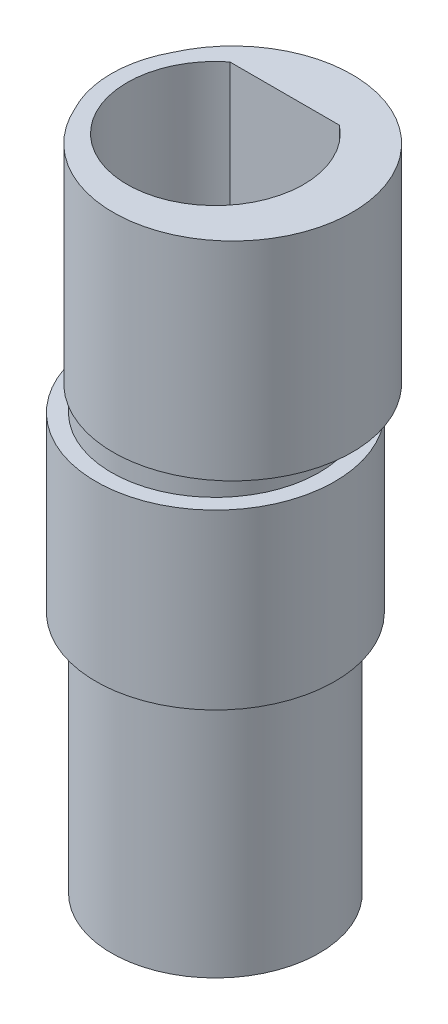
from build123d import *

# Parameters (mm, degrees)
SKETCH1_R                = 3.45
BOSS_EXTRUDE1_DEPTH      = 6
BOSS_EXTRUDE2_DEPTH      = 1
BOSS_EXTRUDE2_DEPTH_BACK = 4
SKETCH2_R                = 3.45
SKETCH3_R                = 3
BOSS_EXTRUDE4_DEPTH      = 22
SKETCH4_R                = 2.55
CUT_EXTRUDE1_DEPTH       = 23.616476295
BOSS_EXTRUDE5_START      = -12.8
BOSS_EXTRUDE5_DEPTH      = 12.8
CUT_EXTRUDE2_START       = -3
SKETCH6_R                = 3
SKETCH6_R_2              = 2.55
CUT_EXTRUDE2_DEPTH       = 3


with BuildPart() as part:
    # Sketch1 → Boss-Extrude1 (new body)
    with BuildSketch(Plane(origin=(0, 0, 0), x_dir=(1, 0, 0), z_dir=(0, 1, 0))):
        Circle(SKETCH1_R)
    extrude(amount=BOSS_EXTRUDE1_DEPTH)



with BuildPart() as body_2:
    # Sketch2 → Boss-Extrude2 (new, two sides: drawn at the far end of the back side and taken through both)
    with BuildSketch(Plane.XZ.offset(4.98).offset(-BOSS_EXTRUDE2_DEPTH_BACK)):
        with Locations((-0.5, 0)):
            Circle(SKETCH2_R)
    extrude(amount=BOSS_EXTRUDE2_DEPTH + BOSS_EXTRUDE2_DEPTH_BACK)


with BuildPart() as part_1:
    add(part.part)

    add(body_2.part)  # Boss-Extrude4 merges body 2
    # Sketch3 → Boss-Extrude4 (add)
    with BuildSketch(Plane(origin=(0, 6, 0), x_dir=(1, 0, 0), z_dir=(0, 1, 0))):
        with Locations((-0.5, 0)):
            Circle(SKETCH3_R)
    extrude(amount=-BOSS_EXTRUDE4_DEPTH)

    # Sketch4 → Cut-Extrude1 (cut, through all)
    with BuildSketch(Plane.XZ.offset(16)):
        with Locations((-0.5, 0)):
            Circle(SKETCH4_R)
    extrude(amount=-CUT_EXTRUDE1_DEPTH, mode=Mode.SUBTRACT)

    # Sketch5 → Boss-Extrude5 (add)
    with BuildSketch(Plane(origin=(0, 6, 0), x_dir=(1, 0, 0), z_dir=(0, 1, 0)).offset(BOSS_EXTRUDE5_START)):
        with BuildLine():
            Line((-2.081929202, 2), (1.081929202, 2))
            ThreePointArc((1.081929202, 2), (-0.5, 2.55), (-2.081929202, 2))
        make_face()
    extrude(amount=BOSS_EXTRUDE5_DEPTH)

    # Sketch6 → Cut-Extrude2 (cut)
    with BuildSketch(Plane.XZ.offset(16).offset(CUT_EXTRUDE2_START)):
        with Locations((-0.5, 0)):
            Circle(SKETCH6_R)
        with Locations((-0.5, 0)):
            Circle(SKETCH6_R_2, mode=Mode.SUBTRACT)
    extrude(amount=CUT_EXTRUDE2_DEPTH, mode=Mode.SUBTRACT)


solid = part_1.part
